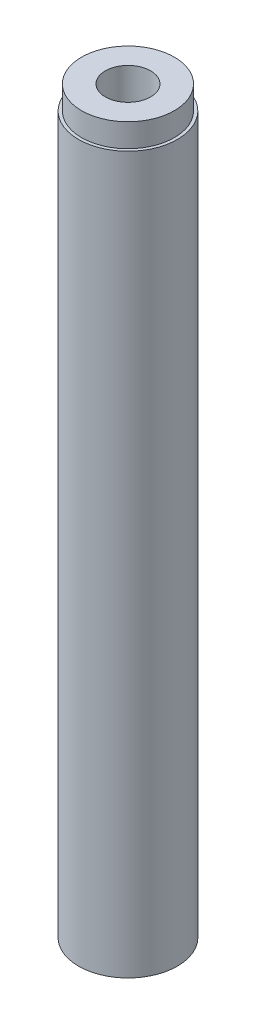
from build123d import *

# Parameters (mm, degrees)
SKETCH1_R           = 6.55
SKETCH1_R_2         = 3
BOSS_EXTRUDE1_DEPTH = 98
CUT_EXTRUDE1_START  = -3.1
SKETCH2_R           = 6.55
SKETCH2_R_2         = 6.15
CUT_EXTRUDE1_DEPTH  = 3.1


with BuildPart() as part:
    # Sketch1 → Boss-Extrude1 (new body)
    with BuildSketch(Plane(origin=(0, 0, 0), x_dir=(1, 0, 0), z_dir=(0, 1, 0))):
        Circle(SKETCH1_R)
        Circle(SKETCH1_R_2, mode=Mode.SUBTRACT)
    extrude(amount=BOSS_EXTRUDE1_DEPTH)

    # Sketch2 → Cut-Extrude1 (cut)
    with BuildSketch(Plane(origin=(0, 98, 0), x_dir=(1, 0, 0), z_dir=(0, 1, 0)).offset(CUT_EXTRUDE1_START)):
        Circle(SKETCH2_R)
        Circle(SKETCH2_R_2, mode=Mode.SUBTRACT)
    extrude(amount=CUT_EXTRUDE1_DEPTH, mode=Mode.SUBTRACT)


solid = part.part
